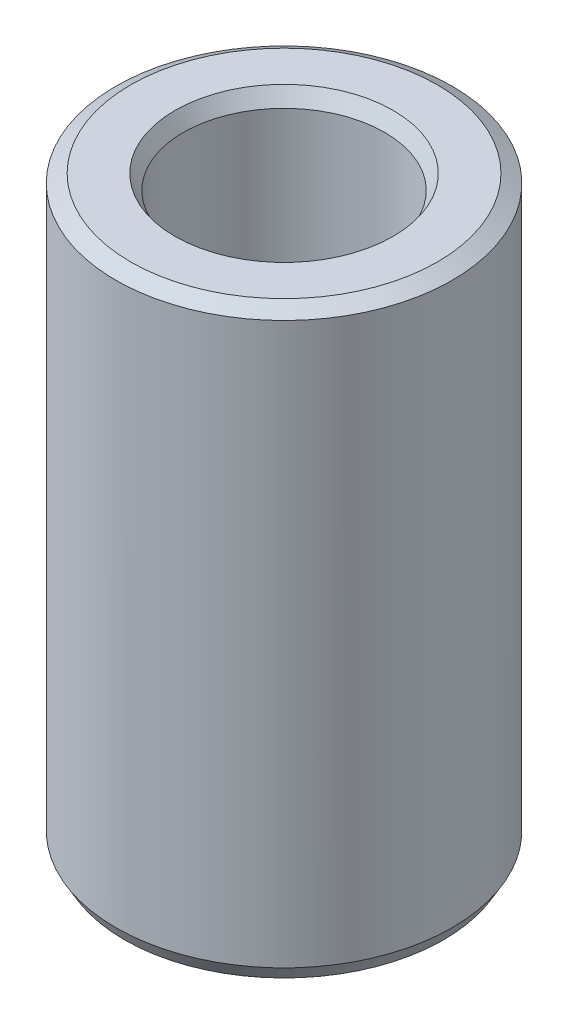
from build123d import *
from OCP.BRepFilletAPI import BRepFilletAPI_MakeChamfer

# Parameters (mm, degrees)
SKETCH1_R           = 52.5
BOSS_EXTRUDE1_DEPTH = 182.31641581
SKETCH2_R           = 31.408147706
CUT_EXTRUDE1_DEPTH  = 197.854706507
CHAMFER1_SIZE       = 2.659611862
CHAMFER1_SIZE2      = 4.606582874


with BuildPart() as part:
    # Sketch1 → Boss-Extrude1 (new body)
    with BuildSketch(Plane(origin=(0, 0, 0), x_dir=(1, 0, 0), z_dir=(0, 1, 0))):
        Circle(SKETCH1_R)
    extrude(amount=BOSS_EXTRUDE1_DEPTH)

    # Sketch2 → Cut-Extrude1 (cut, through all)
    with BuildSketch(Plane(origin=(0, 0, 0), x_dir=(1, 0, 0), z_dir=(0, 1, 0))):
        Circle(SKETCH2_R)
    extrude(amount=CUT_EXTRUDE1_DEPTH, mode=Mode.SUBTRACT)

    # Chamfer1: one chamfer whose edges measure the first distance from different faces: ONE call of the kernel's chamfer builder (chamfer() names one face for all edges)
    chamfer1_edges_1 = [part.edges().sort_by_distance(p)[0] for p in [
        (-31.408147706, 182.31641581, 0),
    ]]
    chamfer1_side_1 = [part.faces().sort_by_distance(p)[0] for p in [
        (-51.01507576, 182.31641581, 0),
    ]]
    chamfer1_edges_2 = [part.edges().sort_by_distance(p)[0] for p in [
        (-31.408147706, 0, 0),
    ]]
    chamfer1_side_2 = [part.faces().sort_by_distance(p)[0] for p in [
        (-31.408147706, 91.158207905, 0),
    ]]
    chamfer1_edges_3 = [part.edges().sort_by_distance(p)[0] for p in [
        (-52.5, 0, 0),
    ]]
    chamfer1_side_3 = [part.faces().sort_by_distance(p)[0] for p in [
        (-51.01507576, 0, 0),
    ]]
    chamfer1_edges_4 = [part.edges().sort_by_distance(p)[0] for p in [
        (-52.5, 182.31641581, 0),
    ]]
    chamfer1_side_4 = [part.faces().sort_by_distance(p)[0] for p in [
        (-52.5, 91.158207905, 0),
    ]]
    chamfer1 = BRepFilletAPI_MakeChamfer(part.part.solid().wrapped)
    for e in chamfer1_edges_1:
        chamfer1.Add(CHAMFER1_SIZE, CHAMFER1_SIZE2, e.wrapped, chamfer1_side_1[0].wrapped)  # the first distance lies on this face
    for e in chamfer1_edges_2:
        chamfer1.Add(CHAMFER1_SIZE, CHAMFER1_SIZE2, e.wrapped, chamfer1_side_2[0].wrapped)  # the first distance lies on this face
    for e in chamfer1_edges_3:
        chamfer1.Add(CHAMFER1_SIZE, CHAMFER1_SIZE2, e.wrapped, chamfer1_side_3[0].wrapped)  # the first distance lies on this face
    for e in chamfer1_edges_4:
        chamfer1.Add(CHAMFER1_SIZE, CHAMFER1_SIZE2, e.wrapped, chamfer1_side_4[0].wrapped)  # the first distance lies on this face
    add(Compound.cast(chamfer1.Shape()), mode=Mode.REPLACE)


solid = part.part
